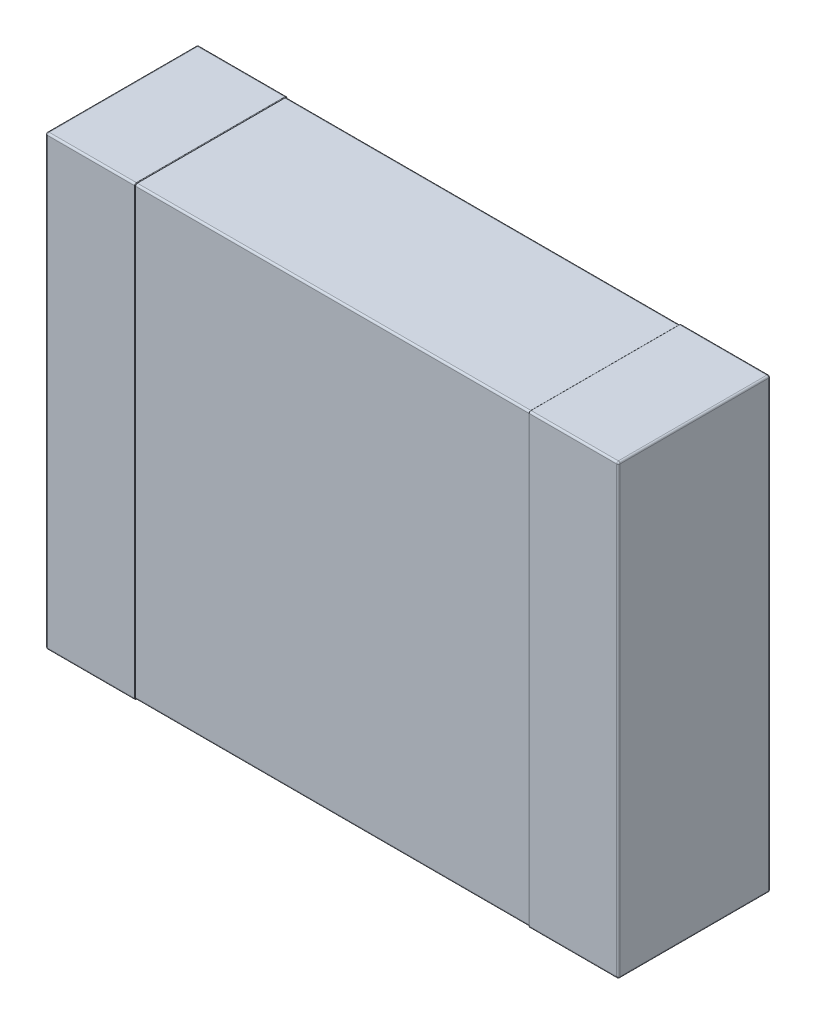
from build123d import *

# Parameters (mm, degrees)
SKETCH1_W                           = 3.2
SKETCH1_H                           = 2.5
ALL_BODY_DEPTH                      = 0.85
CUT_OUT_THE_BODY_FOR_PIN_DEPTH      = 1.1
CUT_OUT_THE_BODY_FOR_PIN_DEPTH_BACK = 1.1
SKETCH2_OUTSIDE_W                   = 3.68
SKETCH2_OUTSIDE_H                   = 5.33
SKETCH2_OUTSIDE_W_2                 = 0.844
SKETCH2_OUTSIDE_H_2                 = 2.494
BODY_FILLET_R                       = 0.01
PIN_FILLET_A_R                      = 0.01
PIN_FILLET_B_R                      = 0.003


with BuildPart() as part:
    # Sketch1 → All body (new body)
    with BuildSketch(Plane.XY):
        Rectangle(SKETCH1_W, SKETCH1_H)
    extrude(amount=ALL_BODY_DEPTH)

    # Sketch2 outside → Cut out the body for pin (cut, two sides: drawn at the far end of the back side and taken through both)
    with BuildSketch(Plane(origin=(0, 0, 0), x_dir=(0, 0, -1), z_dir=(1, 0, 0)).offset(-CUT_OUT_THE_BODY_FOR_PIN_DEPTH_BACK)):
        with Locations((-0.425, 0)):
            Rectangle(SKETCH2_OUTSIDE_W, SKETCH2_OUTSIDE_H)
        with Locations((-0.425, 0)):
            Rectangle(SKETCH2_OUTSIDE_W_2, SKETCH2_OUTSIDE_H_2, mode=Mode.SUBTRACT)
    extrude(amount=CUT_OUT_THE_BODY_FOR_PIN_DEPTH + CUT_OUT_THE_BODY_FOR_PIN_DEPTH_BACK, mode=Mode.SUBTRACT)

    # Body fillet
    body_fillet_edges = [part.edges().sort_by_distance(p)[0] for p in [
        (0, 1.247, 0.003),
        (0, 1.247, 0.847),
        (0, -1.247, 0.847),
        (0, -1.247, 0.003),
    ]]
    fillet(body_fillet_edges, radius=BODY_FILLET_R)

    # Pin fillet a
    pin_fillet_a_edges = [part.edges().sort_by_distance(p)[0] for p in [
        (1.6, 0, 0.85),
        (-1.35, 1.25, 0),
        (1.35, -1.25, 0),
        (1.35, -1.25, 0.85),
        (-1.35, 1.25, 0.85),
        (1.35, 1.25, 0.85),
        (-1.6, 0, 0.85),
        (1.35, 1.25, 0),
        (1.6, 0, 0),
        (-1.35, -1.25, 0),
        (-1.6, 0, 0),
        (-1.6, 1.25, 0.425),
        (1.6, 1.25, 0.425),
        (1.6, -1.25, 0.425),
        (-1.6, -1.25, 0.425),
        (-1.35, -1.25, 0.85),
    ]]
    fillet(pin_fillet_a_edges, radius=PIN_FILLET_A_R)

    # Pin fillet b
    pin_fillet_b_edges = [part.edges().sort_by_distance(p)[0] for p in [
        (1.1, -1.25, 0.425),
        (1.1, 0, 0.85),
        (1.1, 1.25, 0.425),
        (1.1, 0, 0),
        (-1.1, 1.25, 0.425),
        (-1.1, 0, 0.85),
        (-1.1, -1.25, 0.425),
        (-1.1, 0, 0),
        (1.1, 1.247071068, 0.002928932),
        (1.1, -1.247071068, 0.002928932),
        (1.1, -1.247071068, 0.847071068),
        (1.1, 1.247071068, 0.847071068),
        (-1.1, -1.247071068, 0.847071068),
        (-1.1, 1.247071068, 0.847071068),
        (-1.1, -1.247071068, 0.002928932),
        (-1.1, 1.247071068, 0.002928932),
    ]]
    fillet(pin_fillet_b_edges, radius=PIN_FILLET_B_R - 0.0001)  # a hair under: the kernel refuses the full size


solid = part.part
